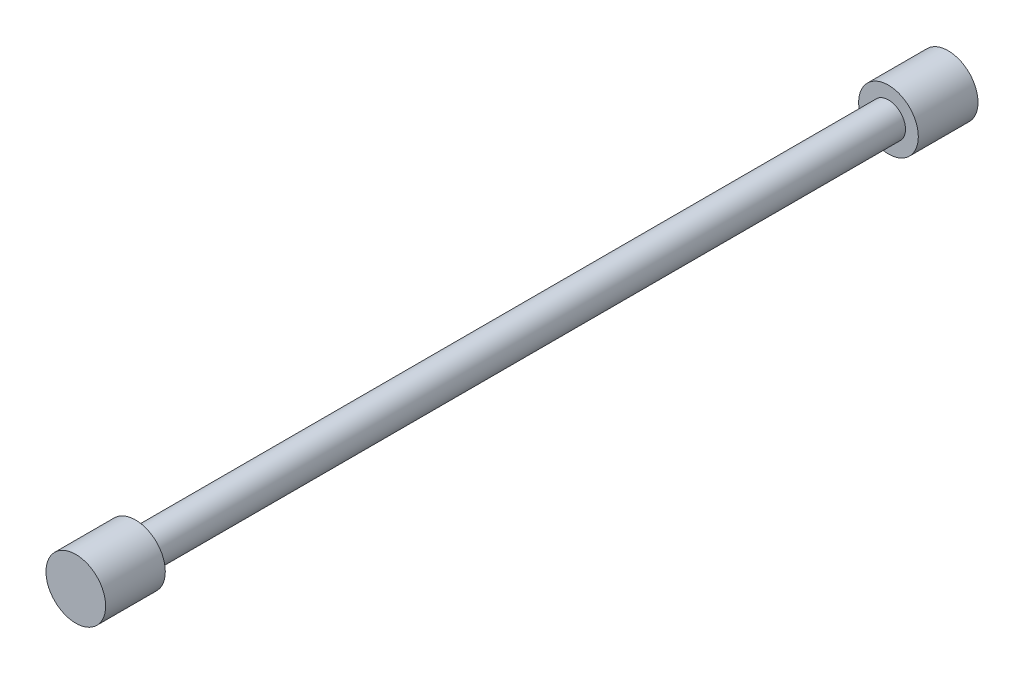
from build123d import *


with BuildPart() as part:
    # SK_Rod → Rod_Body (revolve)
    with BuildSketch(Plane(origin=(0, 0, 0), x_dir=(1, 0, 0), z_dir=(0, 1, 0))):
        Polygon((0, -7), (7, -7), (7, 7), (4, 7), (4, 183.641023917), (7, 183.641023917), (7, 197.641023917), (0, 197.641023917), align=None)
    revolve(axis=Axis((0, 0, 10), (0, 0, -1)))


solid = part.part
